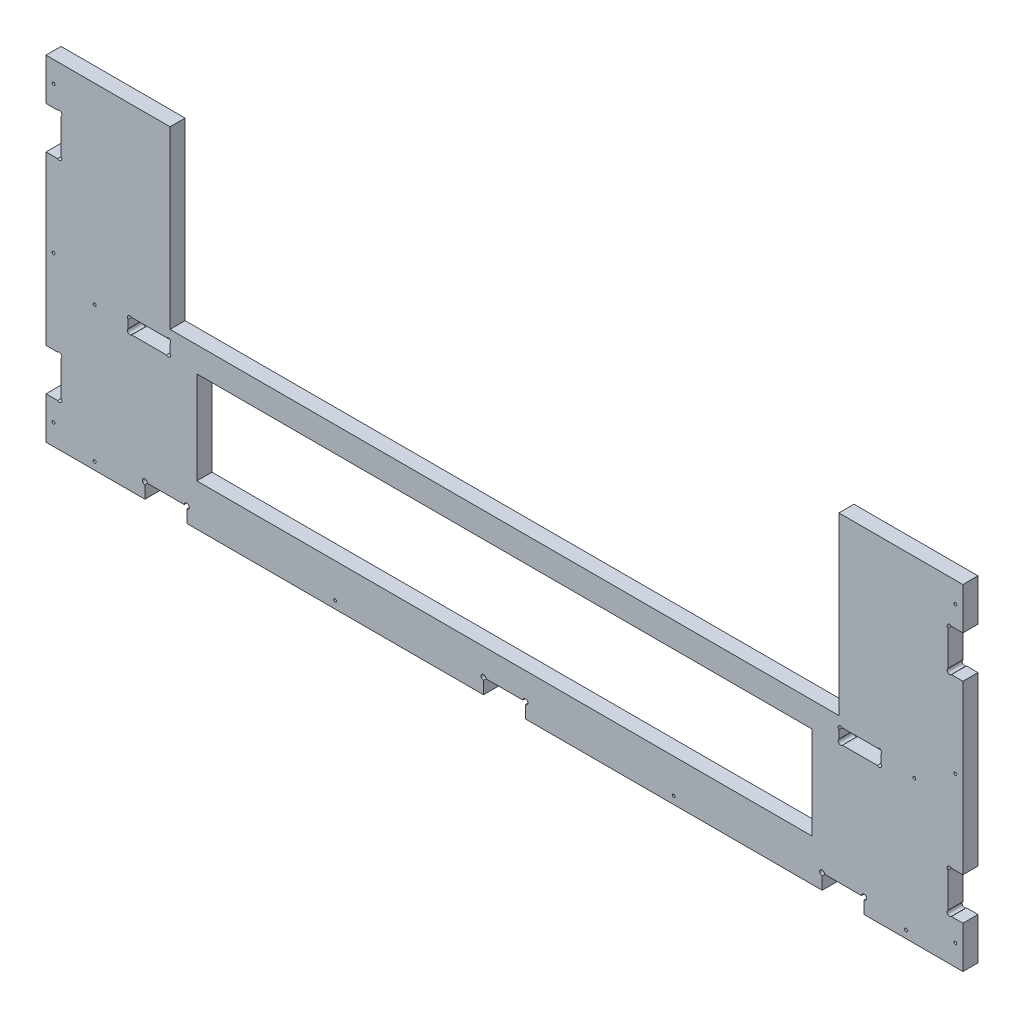
from build123d import *

# Parameters (mm, degrees)
SKETCH1_W            = 1094.236516538
SKETCH1_H            = 400
BOSS_EXTRUDE1_DEPTH  = 18
CAVITY1_START        = -15
CAVITY1_OUTLINE_W    = 18
CAVITY1_OUTLINE_H    = 18
CAVITY1_DEPTH        = 30
CAVITY1_START_2      = 813.236516538
CAVITY1_2_OUTLINE_W  = 18
CAVITY1_2_OUTLINE_H  = 18
CAVITY1_2_DEPTH      = 30
CAVITY1_START_3      = 389.118258269
CAVITY1_3_OUTLINE_W  = 18
CAVITY1_3_OUTLINE_H  = 18
CAVITY1_3_DEPTH      = 50
CAVITY1_START_4      = -35
CAVITY1_4_OUTLINE_W  = 18
CAVITY1_4_OUTLINE_H  = 18
CAVITY1_4_DEPTH      = 20
CAVITY1_START_5      = 15
CAVITY1_5_OUTLINE_W  = 18
CAVITY1_5_OUTLINE_H  = 18
CAVITY1_5_DEPTH      = 20
CAVITY1_START_6      = 793.236516538
CAVITY1_6_OUTLINE_W  = 18
CAVITY1_6_OUTLINE_H  = 18
CAVITY1_6_DEPTH      = 20
CAVITY1_START_7      = 843.236516538
CAVITY1_7_OUTLINE_W  = 18
CAVITY1_7_OUTLINE_H  = 18
CAVITY1_7_DEPTH      = 20
SKETCH2_W            = 18
SKETCH2_H            = 50
CUT_EXTRUDE1_DEPTH   = 987.255362837
SKETCH3_W            = 798.236516538
SKETCH3_H            = 209.4
CUT_EXTRUDE2_DEPTH   = 18
SKETCH4_W            = 734.236516538
SKETCH4_H            = 110.6
CUT_EXTRUDE3_DEPTH   = 20
M3_CLEARANCE_HOLE1_D = 3.4
SKETCH7_R            = 3
CUT_EXTRUDE4_DEPTH   = 30


# Read off the part's stored shape, not the designer's step: Cavity1
with BuildPart() as part:
    # Sketch1 → Boss-Extrude1 (new body)
    with BuildSketch(Plane.XY):
        with Locations((414.118258269, 20)):
            Rectangle(SKETCH1_W, SKETCH1_H)
    extrude(amount=BOSS_EXTRUDE1_DEPTH)

    # Cavity1 outline → Cavity1 (cut)
    with BuildSketch(Plane.YZ.offset(CAVITY1_START)):
        with Locations((-9, 9)):
            Rectangle(CAVITY1_OUTLINE_W, CAVITY1_OUTLINE_H)
        with Locations((-171, 9)):
            Rectangle(CAVITY1_OUTLINE_W, CAVITY1_OUTLINE_H)
    extrude(amount=CAVITY1_DEPTH, mode=Mode.SUBTRACT)

    # Cavity1 2 outline → Cavity1 2 (cut)
    with BuildSketch(Plane.YZ.offset(CAVITY1_START_2)):
        with Locations((-9, 9)):
            Rectangle(CAVITY1_2_OUTLINE_W, CAVITY1_2_OUTLINE_H)
        with Locations((-171, 9)):
            Rectangle(CAVITY1_2_OUTLINE_W, CAVITY1_2_OUTLINE_H)
    extrude(amount=CAVITY1_2_DEPTH, mode=Mode.SUBTRACT)

    # Cavity1 3 outline → Cavity1 3 (cut)
    with BuildSketch(Plane.YZ.offset(CAVITY1_START_3)):
        with Locations((-171, 9)):
            Rectangle(CAVITY1_3_OUTLINE_W, CAVITY1_3_OUTLINE_H)
    extrude(amount=CAVITY1_3_DEPTH, mode=Mode.SUBTRACT)

    # Cavity1 4 outline → Cavity1 4 (cut)
    with BuildSketch(Plane.YZ.offset(CAVITY1_START_4)):
        with Locations((-9, 9)):
            Rectangle(CAVITY1_4_OUTLINE_W, CAVITY1_4_OUTLINE_H)
    extrude(amount=CAVITY1_4_DEPTH, mode=Mode.SUBTRACT)

    # Cavity1 5 outline → Cavity1 5 (cut)
    with BuildSketch(Plane.YZ.offset(CAVITY1_START_5)):
        with Locations((-171, 9)):
            Rectangle(CAVITY1_5_OUTLINE_W, CAVITY1_5_OUTLINE_H)
    extrude(amount=CAVITY1_5_DEPTH, mode=Mode.SUBTRACT)

    # Cavity1 6 outline → Cavity1 6 (cut)
    with BuildSketch(Plane.YZ.offset(CAVITY1_START_6)):
        with Locations((-171, 9)):
            Rectangle(CAVITY1_6_OUTLINE_W, CAVITY1_6_OUTLINE_H)
    extrude(amount=CAVITY1_6_DEPTH, mode=Mode.SUBTRACT)

    # Cavity1 7 outline → Cavity1 7 (cut)
    with BuildSketch(Plane.YZ.offset(CAVITY1_START_7)):
        with Locations((-9, 9)):
            Rectangle(CAVITY1_7_OUTLINE_W, CAVITY1_7_OUTLINE_H)
    extrude(amount=CAVITY1_7_DEPTH, mode=Mode.SUBTRACT)

    # Sketch2 → Cut-Extrude1 (cut, through all)
    with BuildSketch(Plane.XY.offset(18)):
        with Locations((952.236516538, 145)):
            Rectangle(SKETCH2_W, SKETCH2_H)
        with Locations((952.236516538, -105)):
            Rectangle(SKETCH2_W, SKETCH2_H)
        with Locations((-124, -105)):
            Rectangle(SKETCH2_W, SKETCH2_H)
        with Locations((-124, 145)):
            Rectangle(SKETCH2_W, SKETCH2_H)
    extrude(amount=-CUT_EXTRUDE1_DEPTH, mode=Mode.SUBTRACT)

    # Sketch3 → Cut-Extrude2 (cut)
    with BuildSketch(Plane.XY.offset(18)):
        with Locations((414.118258269, 115.3)):
            Rectangle(SKETCH3_W, SKETCH3_H)
    extrude(amount=-CUT_EXTRUDE2_DEPTH, mode=Mode.SUBTRACT)

    # Sketch4 → Cut-Extrude3 (cut)
    with BuildSketch(Plane.XY.offset(18)):
        with Locations((414.118258269, -74.7)):
            Rectangle(SKETCH4_W, SKETCH4_H)
    extrude(amount=-CUT_EXTRUDE3_DEPTH, mode=Mode.SUBTRACT)

    # M3 Clearance Hole1 (through all)
    with Locations(Plane.XY.offset(18)):
        with Locations((-75, -9), (903.236516538, -9), (-75, -171), (212.059129134, -171), (616.177387403, -171), (893.236516538, -171), (952.236516538, -155), (952.236516538, 20), (952.236516538, 195), (-124, -155), (-124, 20), (-124, 195)):
            Hole(M3_CLEARANCE_HOLE1_D / 2)

    # Sketch7 → Cut-Extrude4 (cut)
    with BuildSketch(Plane.XY.offset(18)):
        with Locations((945.357836881, 122.121320344)):
            Circle(SKETCH7_R)
        with Locations((945.357836881, 167.878679656)):
            Circle(SKETCH7_R)
        with Locations((861.115196194, -15.878679656)):
            Circle(SKETCH7_R)
        with Locations((861.115196194, -2.121320344)):
            Circle(SKETCH7_R)
        with Locations((815.357836881, -2.121320344)):
            Circle(SKETCH7_R)
        with Locations((815.357836881, -15.878679656)):
            Circle(SKETCH7_R)
        with Locations((945.357836881, -127.878679656)):
            Circle(SKETCH7_R)
        with Locations((945.357836881, -82.121320344)):
            Circle(SKETCH7_R)
        with Locations((-117.121320344, 167.878679656)):
            Circle(SKETCH7_R)
        with Locations((-117.121320344, 122.121320344)):
            Circle(SKETCH7_R)
        with Locations((-117.121320344, -82.121320344)):
            Circle(SKETCH7_R)
        with Locations((-117.121320344, -127.878679656)):
            Circle(SKETCH7_R)
        with Locations((-32.878679656, -2.121320344)):
            Circle(SKETCH7_R)
        with Locations((-32.878679656, -15.878679656)):
            Circle(SKETCH7_R)
        with Locations((12.878679656, -15.878679656)):
            Circle(SKETCH7_R)
        with Locations((12.878679656, -2.121320344)):
            Circle(SKETCH7_R)
        with Locations((-15, -162)):
            Circle(SKETCH7_R)
        with Locations((35, -162)):
            Circle(SKETCH7_R)
        with Locations((793.236516538, -162)):
            Circle(SKETCH7_R)
        with Locations((843.236516538, -162)):
            Circle(SKETCH7_R)
        with Locations((389.116516538, -162)):
            Circle(SKETCH7_R)
        with Locations((439.116516538, -162)):
            Circle(SKETCH7_R)
    extrude(amount=-CUT_EXTRUDE4_DEPTH, mode=Mode.SUBTRACT)


solid = part.part
